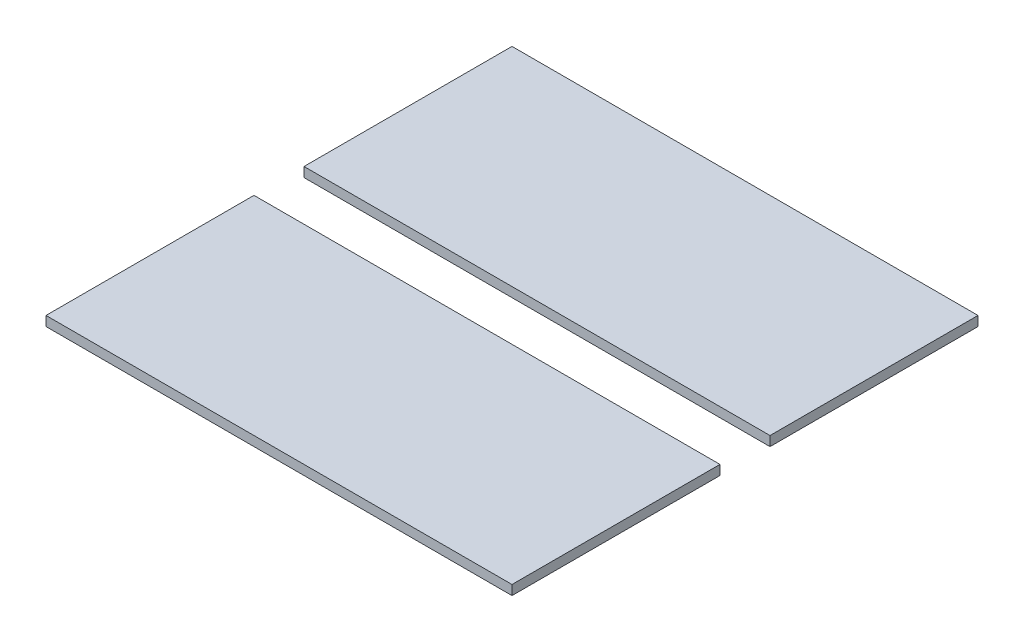
from build123d import *

# Parameters (mm, degrees)
SKETCH1_W           = 4908.55
SKETCH1_H           = 4908.55
BOSS_EXTRUDE1_DEPTH = 101.6
SKETCH2_W           = 4908.55
SKETCH2_H           = 527.05
CUT_EXTRUDE1_DEPTH  = 3473.355700566


with BuildPart() as part:
    # Sketch1 → Boss-Extrude1 (new body)
    with BuildSketch(Plane(origin=(0, 0, 0), x_dir=(1, 0, 0), z_dir=(0, 1, 0))):
        Rectangle(SKETCH1_W, SKETCH1_H)
    extrude(amount=BOSS_EXTRUDE1_DEPTH)

    # Sketch2 → Cut-Extrude1 (cut, through all)
    with BuildSketch(Plane(origin=(0, 101.6, 0), x_dir=(1, 0, 0), z_dir=(0, 1, 0))):
        Rectangle(SKETCH2_W, SKETCH2_H)
    extrude(amount=-CUT_EXTRUDE1_DEPTH, mode=Mode.SUBTRACT)


with BuildPart() as cut_extrude1_piece_1:
    # of the separate pieces the step leaves, piece 1, a body of its own (cut_extrude1_pieces)
    add(part.part.solids().sort_by_distance((-2454.275, 0, -2454.275))[0])


with BuildPart() as cut_extrude1_piece_2:
    # of the separate pieces the step leaves, piece 2, a body of its own (cut_extrude1_pieces)
    add(part.part.solids().sort_by_distance((-2454.275, 0, 2454.275))[0])


solid = Compound([cut_extrude1_piece_1.part, cut_extrude1_piece_2.part])
